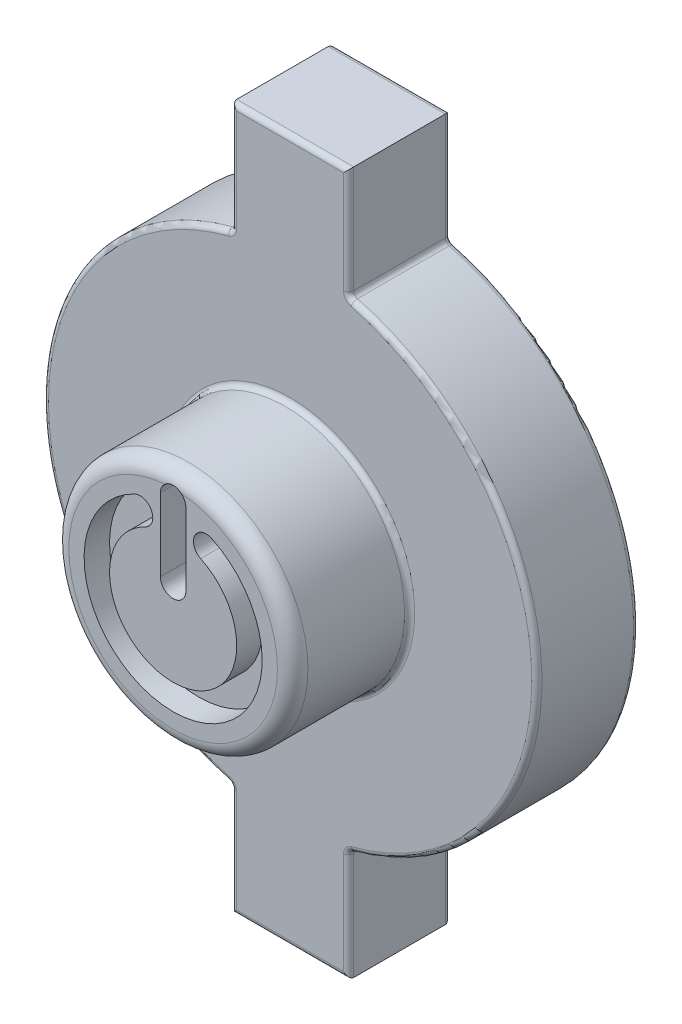
from build123d import *

# Parameters (mm, degrees)
ESBO_O1_R                = 2.35
RESSALTO_EXTRUS_O1_DEPTH = 2.3
ESBO_O2_R                = 4.85
RESSALTO_EXTRUS_O2_DEPTH = 2
RESSALTO_EXTRUS_O3_START = -2
RESSALTO_EXTRUS_O3_DEPTH = 2
FILETE1_R                = 0.1
FILETE2_R                = 0.1
FILETE3_R                = 0.3
FILETE4_R                = 0.1
CORTE_EXTRUS_O1_DEPTH    = 0.5


with BuildPart() as part:
    # Esboço1 → Ressalto-extrusão1 (new body)
    with BuildSketch(Plane.XY):
        Circle(ESBO_O1_R)
    extrude(amount=RESSALTO_EXTRUS_O1_DEPTH)

    # Esboço2 → Ressalto-extrusão2 (add)
    with BuildSketch(Plane(origin=(0, 0, 0), x_dir=(-1, 0, 0), z_dir=(0, 0, -1))):
        Circle(ESBO_O2_R)
    extrude(amount=RESSALTO_EXTRUS_O2_DEPTH)

    # Esboço3 → Ressalto-extrusão3 (add)
    with BuildSketch(Plane(origin=(0, 0, -2), x_dir=(-1, 0, 0), z_dir=(0, 0, -1)).offset(RESSALTO_EXTRUS_O3_START)):
        with BuildLine():
            Line((1.15, 6.9), (-1.15, 6.9))
            Line((-1.15, 6.9), (-1.15, 4.711687596))
            ThreePointArc((-1.15, 4.711687596), (0, 4.85), (1.15, 4.711687596))
            Line((1.15, 4.711687596), (1.15, 6.9))
        make_face()
        with BuildLine():
            Line((1.15, -6.9), (1.15, -4.711687596))
            ThreePointArc((1.15, -4.711687596), (0, -4.85), (-1.15, -4.711687596))
            Line((-1.15, -4.711687596), (-1.15, -6.9))
            Line((-1.15, -6.9), (1.15, -6.9))
        make_face()
    extrude(amount=RESSALTO_EXTRUS_O3_DEPTH)

    # Filete1
    filete1_edges = [part.edges().sort_by_distance(p)[0] for p in [
        (-1.15, 4.711687596, -1),
        (1.15, 4.711687596, -1),
    ]]
    fillet(filete1_edges, radius=FILETE1_R)

    # Filete2
    filete2_edges = [part.edges().sort_by_distance(p)[0] for p in [
        (-1.15, -4.711687596, -1),
        (1.15, -4.711687596, -1),
        (0, 6.9, -2),
        (-1.15, 5.844786003, -2),
        (-1.170863243, 4.728437942, -2),
        (-4.849846816, -0.038546843, -2),
        (-1.15, -5.805843798, -2),
        (0, -6.9, -2),
        (1.15, -5.805843798, -2),
        (4.849846816, -0.038546843, -2),
        (1.170863243, 4.728437942, -2),
        (1.15, 5.844786003, -2),
    ]]
    fillet(filete2_edges, radius=FILETE2_R)

    # Filete3
    filete3_edges = [part.edges().sort_by_distance(p)[0] for p in [
        (-2.35, 0, 2.3),
    ]]
    fillet(filete3_edges, radius=FILETE3_R)

    # Filete4
    filete4_edges = [part.edges().sort_by_distance(p)[0] for p in [
        (1.170863243, -4.728437942, 0),
        (1.15, -5.844786003, 0),
        (0, -6.9, 0),
        (-1.15, -5.844786003, 0),
        (-1.170863243, -4.728437942, 0),
        (-4.85, 0, 0),
        (-1.170863243, 4.728437942, 0),
        (-1.15, 5.844786003, 0),
        (0, 6.9, 0),
        (1.15, 5.844786003, 0),
        (1.170863243, 4.728437942, 0),
        (4.85, 0, 0),
        (-2.35, 0, 0),
    ]]
    fillet(filete4_edges, radius=FILETE4_R)

    # Esboço5 → Corte-extrusão1 (cut)
    with BuildSketch(Plane.XY.offset(2.3)):
        with BuildLine():
            Line((-0.25, 1.851850583), (-0.25, 0.424695077))
            ThreePointArc((-0.25, 0.424695077), (0, 0.174695077), (0.25, 0.424695077))
            Line((0.25, 0.424695077), (0.25, 1.851850583))
            ThreePointArc((0.25, 1.851850583), (0, 2.101850583), (-0.25, 1.851850583))
        make_face()
        with BuildLine():
            ThreePointArc((-0.758333333, 1.577159014), (0, -1.75), (0.758333333, 1.577159014))
            ThreePointArc((0.758333333, 1.577159014), (0.424691569, 1.460183917), (0.541666667, 1.126542153))
            ThreePointArc((0.541666667, 1.126542153), (0, -1.25), (-0.541666667, 1.126542153))
            ThreePointArc((-0.541666667, 1.126542153), (-0.424691569, 1.460183917), (-0.758333333, 1.577159014))
        make_face()
    extrude(amount=-CORTE_EXTRUS_O1_DEPTH, mode=Mode.SUBTRACT)


solid = part.part
